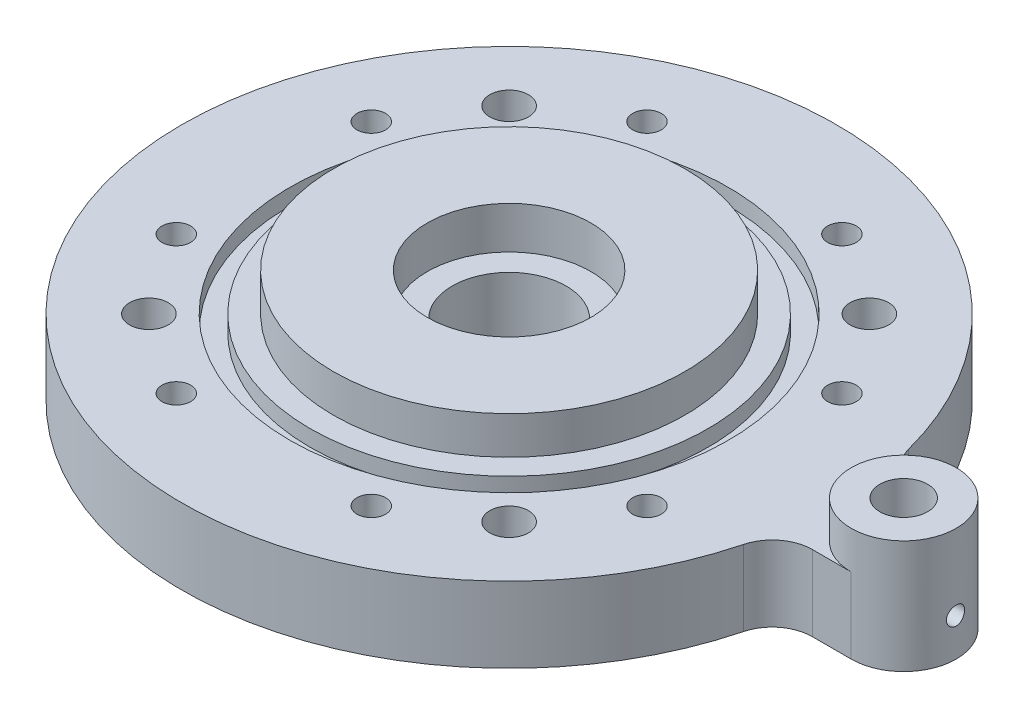
from build123d import *

# Parameters (mm, degrees)
BASE_DEPTH                       = 13.175
SKETCH3_R                        = 3.373437
SKETCH3_R_2                      = 3.373438
SQUARE_BOLT_HOLES_DEPTH          = 98.608945
SKETCH4_R                        = 2.5
HOUSING_BOLTS_DEPTH              = 44.33
CIRPATTERN1_COUNT                = 8
SKETCH2_R                        = 30.6705
SKETCH2_R_2                      = 9.167187
SKETCH2_R_3                      = 4.167187
IMPELLER_CAVITY_RISER_DEPTH      = 6.59
SKETCH5_R                        = 14.2875
SEAL_BORE_DEPTH                  = 7.35
SKETCH6_R                        = 9.9375
BORE_DEPTH                       = 39.3
PRESSURE_TAP_DEPTH               = 130.310741
PRESSURE_TAP_DEPTH_BACK          = 57.15
SKETCH9_R                        = 1.5875
SKETCH10_R                       = 1.5875
PRESSURE_TAP_VERTICAL_HOLE_DEPTH = 8.175
SKETCH12_R                       = 38.2524
SKETCH12_R_2                     = 34.7218
O_RING_FEATURE_DEPTH             = 2.82448


with BuildPart() as part:
    # Sketch1 → base (new body)
    with BuildSketch(Plane(origin=(0, 0, 0), x_dir=(1, 0, 0), z_dir=(0, 1, 0))):
        with BuildLine():
            Line((62.079341, 9.167187), (68.857187, 9.167187))
            ThreePointArc((68.857187, 9.167187), (78.024375, 0), (68.857187, -9.167187))
            Line((68.857187, -9.167187), (62.079341, -9.167187))
            ThreePointArc((62.079341, -9.167187), (57.798515, -10.628728), (55.30529, -14.403036))
            ThreePointArc((55.30529, -14.403036), (-57.15, 0), (55.30529, 14.403036))
            ThreePointArc((55.30529, 14.403036), (57.798515, 10.628728), (62.079341, 9.167187))
        make_face()
    extrude(amount=BASE_DEPTH)

    # Sketch3 → square bolt holes (cut, through all)
    with BuildSketch(Plane.XZ):
        with Locations((-31.430896, -31.430896)):
            Circle(SKETCH3_R)
        with Locations((-31.430896, 31.430896)):
            Circle(SKETCH3_R)
        with Locations((31.430896, 31.430896)):
            Circle(SKETCH3_R_2)
        with Locations((31.430896, -31.430896)):
            Circle(SKETCH3_R_2)
    extrude(amount=-SQUARE_BOLT_HOLES_DEPTH, mode=Mode.SUBTRACT)

    # Sketch4 → housing bolts (cut)
    with BuildSketch(Plane(origin=(0, 13.175, 0), x_dir=(1, 0, 0), z_dir=(0, 1, 0))):
        with Locations((17.010279, 41.066445)):
            Circle(SKETCH4_R)
    housing_bolts = extrude(amount=-HOUSING_BOLTS_DEPTH, mode=Mode.SUBTRACT)

    # CirPattern1: housing bolts ×8 about axis
    cirpattern1_axis = Axis((0, 13.175, 0), (0, 1, 0))
    for i in range(1, CIRPATTERN1_COUNT):
        add(housing_bolts.rotate(cirpattern1_axis, i * 360 / CIRPATTERN1_COUNT), mode=Mode.SUBTRACT)

    # Sketch2 → impeller cavity riser (add)
    # profile 1 of 2: a face of its own
    with BuildSketch(Plane(origin=(0, 13.175, 0), x_dir=(1, 0, 0), z_dir=(0, 1, 0))):
        Circle(SKETCH2_R)
    # profile 2 of 2: a face of its own
    with BuildSketch(Plane(origin=(0, 13.175, 0), x_dir=(1, 0, 0), z_dir=(0, 1, 0))):
        with Locations((68.857187, 0)):
            Circle(SKETCH2_R_2)
        with Locations((68.857187, 0)):
            Circle(SKETCH2_R_3, mode=Mode.SUBTRACT)
    extrude(amount=IMPELLER_CAVITY_RISER_DEPTH)

    # Sketch5 → seal bore (cut)
    with BuildSketch(Plane(origin=(0, 19.765, 0), x_dir=(1, 0, 0), z_dir=(0, 1, 0))):
        Circle(SKETCH5_R)
    extrude(amount=-SEAL_BORE_DEPTH, mode=Mode.SUBTRACT)

    # Sketch6 → bore (cut)
    with BuildSketch(Plane(origin=(0, 12.415, 0), x_dir=(1, 0, 0), z_dir=(0, 1, 0))):
        Circle(SKETCH6_R)
    extrude(amount=-BORE_DEPTH, mode=Mode.SUBTRACT)

    # Sketch9 → pressure tap (cut, two sides: drawn at the far end of the back side and taken through both)
    with BuildSketch(Plane(origin=(57.15, 0, 0), x_dir=(0, 0, -1), z_dir=(1, 0, 0)).offset(-PRESSURE_TAP_DEPTH_BACK)):
        with Locations((0, 6.5875)):
            Circle(SKETCH9_R)
    extrude(amount=PRESSURE_TAP_DEPTH + PRESSURE_TAP_DEPTH_BACK, mode=Mode.SUBTRACT)

    # Sketch10 → pressure tap vertical hole (cut)
    with BuildSketch(Plane(origin=(0, 13.175, 0), x_dir=(1, 0, 0), z_dir=(0, 1, 0))):
        with Locations((68.857187, 0)):
            Circle(SKETCH10_R)
    extrude(amount=-PRESSURE_TAP_VERTICAL_HOLE_DEPTH, mode=Mode.SUBTRACT)

    # Sketch12 → o ring feature (cut)
    with BuildSketch(Plane(origin=(0, 13.175, 0), x_dir=(1, 0, 0), z_dir=(0, 1, 0))):
        Circle(SKETCH12_R)
        Circle(SKETCH12_R_2, mode=Mode.SUBTRACT)
    extrude(amount=-O_RING_FEATURE_DEPTH, mode=Mode.SUBTRACT)


solid = part.part
